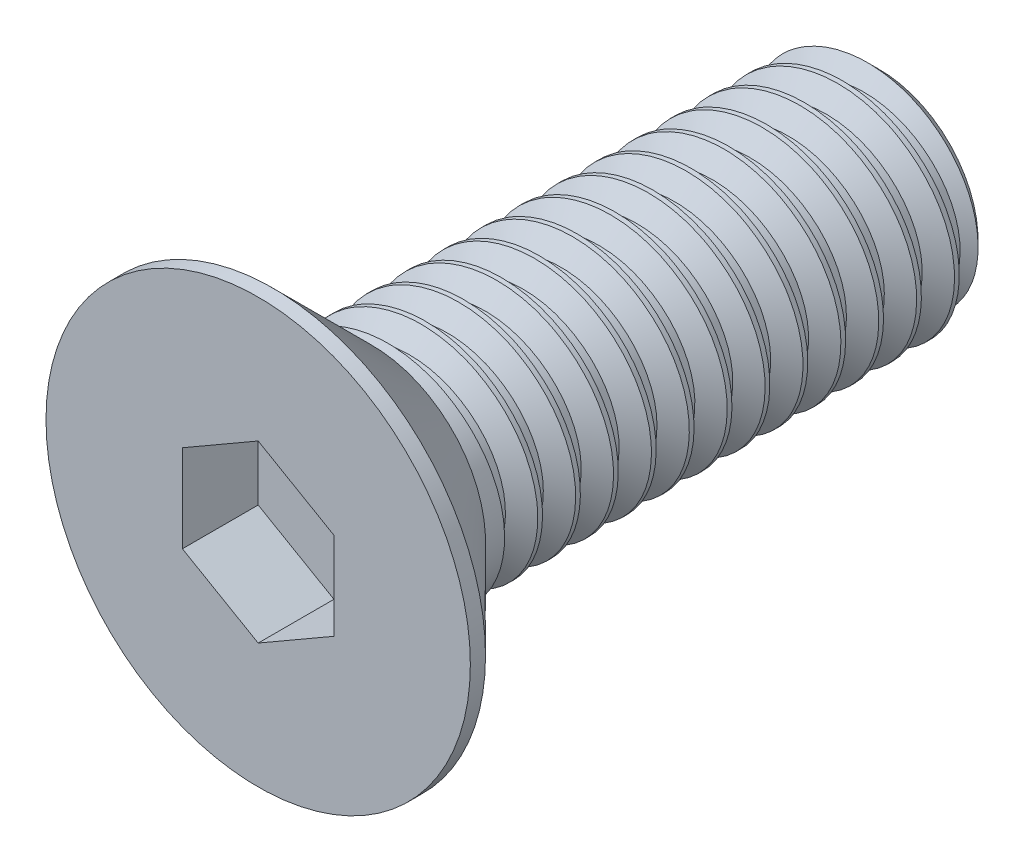
from build123d import *

# Parameters (mm, degrees)
CUT_EXTRUDE1_DEPTH = 1
THREAD1_PITCH      = 0.5


with BuildPart() as part:
    # Sketch2 → Revolve1 (revolve)
    with BuildSketch(Plane.YZ, mode=Mode.PRIVATE) as revolve1_sk:
        Polygon((0, 0), (2.8, 0), (2.8, -0.2), (1.5, -1.5), (1.5, -8), (1.3, -8.2), (0, -8.2), (0, -8), align=None)
    revolve(revolve1_sk.sketch.rotate(Axis((0, 0, -8), (0, 0, 1)), 90), axis=Axis((0, 0, -8), (0, 0, 1)))

    # Sketch3 → Cut-Extrude1 (cut)
    with BuildSketch(Plane.XY):
        Polygon((1, 0.577350269), (0, 1.154700538), (-1, 0.577350269), (-1, -0.577350269), (0, -1.154700538), (1, -0.577350269), align=None)
    extrude(amount=-CUT_EXTRUDE1_DEPTH, mode=Mode.SUBTRACT)

    # Thread1: the profile of Thread Profile1 profile screwed along a right-hand helix of 13 turns, 6 arcs to a turn; built about Z, then put on its axis
    thread1_z = Axis((0, 0, 0), (0, 0, 1))
    thread1_corners = [(1.5003, 0, -0.000173205), (1.5003, 0, 0.437673204), (1.229367063, 0, 0.281249999), (1.229367063, 0, 0.156249999)]
    with BuildLine(mode=Mode.PRIVATE) as thread1_profile:
        Line(thread1_corners[0], thread1_corners[1])
        Line(thread1_corners[1], thread1_corners[2])
        Line(thread1_corners[2], thread1_corners[3])
        Line(thread1_corners[3], thread1_corners[0])
    thread1_cap = Face(thread1_profile.wire())
    thread1_turn_angles = [0, 30, 60, 90, 120, 150, 180, 210, 240, 270, 300, 330, 360]
    thread1_turn_weights = [1, 0.8660254037844387, 1, 0.8660254037844387, 1, 0.8660254037844387, 1, 0.8660254037844387, 1, 0.8660254037844387, 1, 0.8660254037844387, 1]
    thread1_turn_rails = [Edge.make_bspline([Vector(p[0], p[1], 0).rotate(thread1_z, thread1_turn_angles[k]) / thread1_turn_weights[k] + Vector(0, 0, p[2] + THREAD1_PITCH * thread1_turn_angles[k] / 360) for k in range(13)], [0, 0, 0, 1, 1, 2, 2, 3, 3, 4, 4, 5, 5, 6, 6, 6], 2, thread1_turn_weights) for p in thread1_corners]
    thread1_turn_sides = [Face.make_surface_from_curves(thread1_turn_rails[p[0]], thread1_turn_rails[p[1]]) for p in [(0, 1), (1, 2), (2, 3), (3, 0)]]
    thread1 = Plane(origin=(0, 0, -1.5), x_dir=(-1, 0, 0), z_dir=(0, 0, -1)) * Solid(Shell([*[p.moved(Location((0, 0, THREAD1_PITCH * i))) for i in range(13) for p in thread1_turn_sides], thread1_cap, thread1_cap.rotate(thread1_z, 4680).moved(Location((0, 0, THREAD1_PITCH * 4680 / 360)))]))
    add(thread1, mode=Mode.SUBTRACT)


solid = part.part
